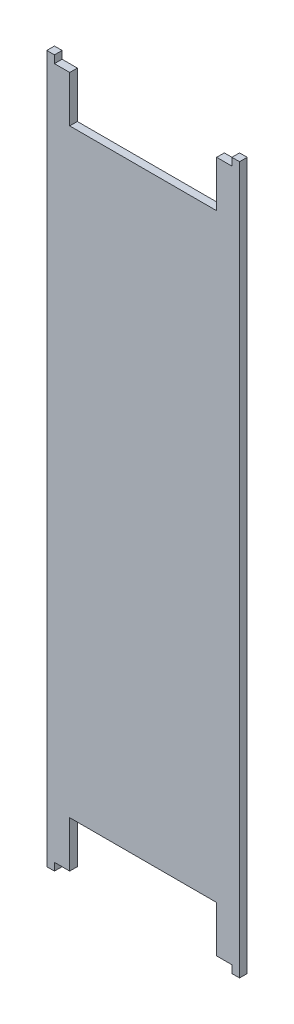
from build123d import *

# Parameters (mm, degrees)
SKETCH1_W           = 41.65
SKETCH1_H           = 152.75
BOSS_EXTRUDE1_DEPTH = 1.65
SKETCH3_W           = 38.35
SKETCH3_H           = 1.65
CUT_EXTRUDE1_DEPTH  = 1.65
SKETCH4_W           = 31.75
SKETCH4_H           = 1.65
CUT_EXTRUDE2_DEPTH  = 10


with BuildPart() as part:
    # Sketch1 → Boss-Extrude1 (new body)
    with BuildSketch(Plane.XY):
        Rectangle(SKETCH1_W, SKETCH1_H)
    extrude(amount=BOSS_EXTRUDE1_DEPTH)

    # Sketch3 → Cut-Extrude1 (cut)
    with BuildSketch(Plane(origin=(0, 76.375, 0), x_dir=(1, 0, 0), z_dir=(0, 1, 0))):
        with Locations((0, -0.825)):
            Rectangle(SKETCH3_W, SKETCH3_H)
    cut_extrude1 = extrude(amount=-CUT_EXTRUDE1_DEPTH, mode=Mode.SUBTRACT)

    # Mirror1: Cut-Extrude1 across plane
    add(cut_extrude1.mirror(Plane.ZX), mode=Mode.SUBTRACT)

    # Sketch4 → Cut-Extrude2 (cut)
    with BuildSketch(Plane(origin=(0, 74.725, 0), x_dir=(1, 0, 0), z_dir=(0, 1, 0))):
        with Locations((0, -0.825)):
            Rectangle(SKETCH4_W, SKETCH4_H)
    cut_extrude2 = extrude(amount=-CUT_EXTRUDE2_DEPTH, mode=Mode.SUBTRACT)

    # Mirror2: Cut-Extrude2 across plane
    add(cut_extrude2.mirror(Plane.ZX), mode=Mode.SUBTRACT)


solid = part.part
